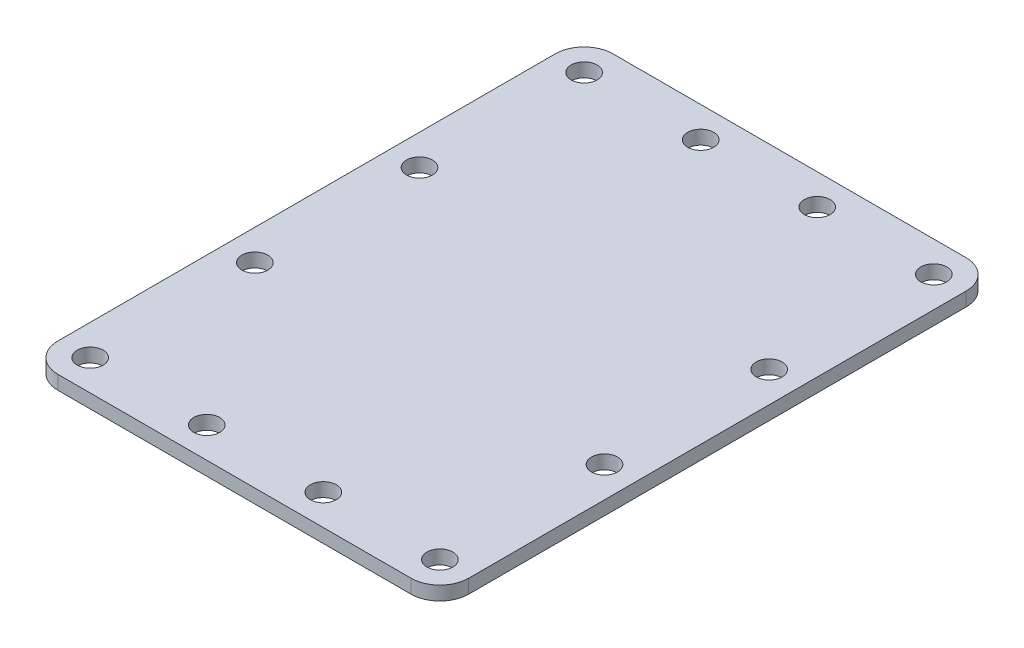
from build123d import *

# Parameters (mm, degrees)
ESBO_O1_R          = 4.5
FLANGE_BASE1_DEPTH = 4.8


# Sheet-metal steps are written as plain solids
with BuildPart() as part:
    # Esboço1 → Flange-base1 (new body)
    with BuildSketch(Plane(origin=(0, 0, 0), x_dir=(1, 0, 0), z_dir=(0, 1, 0))):
        with BuildLine():
            Line((-61.2, -96.2), (61.2, -96.2))
            ThreePointArc((61.2, -96.2), (68.271067812, -93.271067812), (71.2, -86.2))
            Line((71.2, -86.2), (71.2, 86.2))
            ThreePointArc((71.2, 86.2), (68.271067812, 93.271067812), (61.2, 96.2))
            Line((61.2, 96.2), (-61.2, 96.2))
            ThreePointArc((-61.2, 96.2), (-68.271067812, 93.271067812), (-71.2, 86.2))
            Line((-71.2, 86.2), (-71.2, -86.2))
            ThreePointArc((-71.2, -86.2), (-68.271067812, -93.271067812), (-61.2, -96.2))
        make_face()
        with Locations(Location((-60.6, 85.6, 0), (0, 0, 270))):
            Circle(ESBO_O1_R, mode=Mode.SUBTRACT)
        with Locations(Location((60.6, 85.6, 0), (0, 0, 270))):
            Circle(ESBO_O1_R, mode=Mode.SUBTRACT)
        with Locations(Location((-60.6, -85.6, 0), (0, 0, 270))):
            Circle(ESBO_O1_R, mode=Mode.SUBTRACT)
        with Locations(Location((60.6, -85.6, 0), (0, 0, 270))):
            Circle(ESBO_O1_R, mode=Mode.SUBTRACT)
        with Locations(Location((-20.2, 85.6, 0), (0, 0, 270))):
            Circle(ESBO_O1_R, mode=Mode.SUBTRACT)
        with Locations(Location((20.2, 85.6, 0), (0, 0, 270))):
            Circle(ESBO_O1_R, mode=Mode.SUBTRACT)
        with Locations(Location((60.6, 28.533333333, 0), (0, 0, 270))):
            Circle(ESBO_O1_R, mode=Mode.SUBTRACT)
        with Locations(Location((60.6, -28.533333333, 0), (0, 0, 270))):
            Circle(ESBO_O1_R, mode=Mode.SUBTRACT)
        with Locations(Location((20.2, -85.6, 0), (0, 0, 90))):
            Circle(ESBO_O1_R, mode=Mode.SUBTRACT)
        with Locations(Location((-20.2, -85.6, 0), (0, 0, 90))):
            Circle(ESBO_O1_R, mode=Mode.SUBTRACT)
        with Locations(Location((-60.6, -28.533333333, 0), (0, 0, 90))):
            Circle(ESBO_O1_R, mode=Mode.SUBTRACT)
        with Locations(Location((-60.6, 28.533333333, 0), (0, 0, 90))):
            Circle(ESBO_O1_R, mode=Mode.SUBTRACT)
    extrude(amount=-FLANGE_BASE1_DEPTH)


solid = part.part
